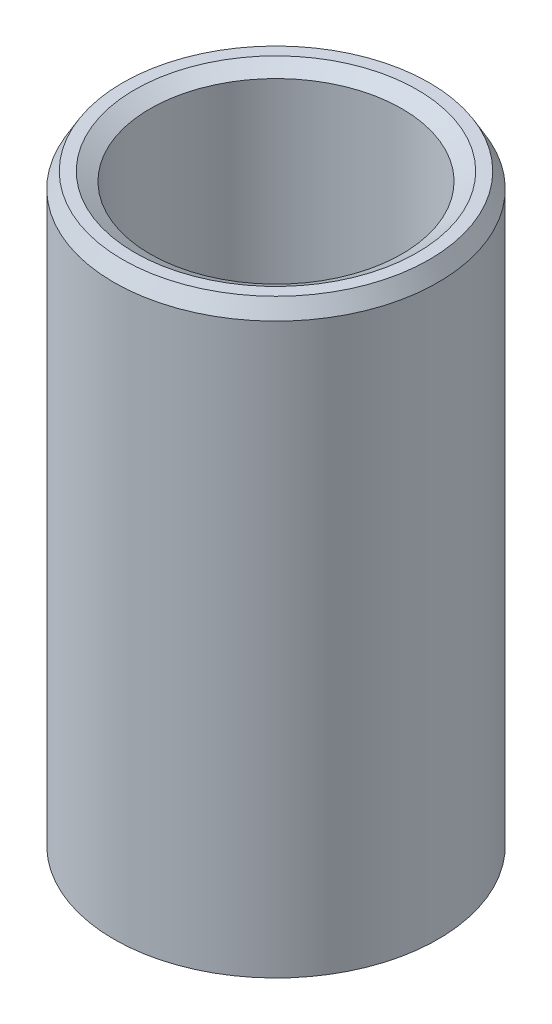
from build123d import *
from OCP.BRepFilletAPI import BRepFilletAPI_MakeChamfer

# Parameters (mm, degrees)
SKETCH1_R           = 15
BOSS_EXTRUDE1_DEPTH = 54.86769485
SKETCH2_R           = 11.651076825
CUT_EXTRUDE1_DEPTH  = 59.82570814
CHAMFER1_SIZE       = 1.415614988
CHAMFER1_SIZE2      = 0.817305694


with BuildPart() as part:
    # Sketch1 → Boss-Extrude1 (new body)
    with BuildSketch(Plane(origin=(0, 0, 0), x_dir=(1, 0, 0), z_dir=(0, 1, 0))):
        Circle(SKETCH1_R)
    extrude(amount=BOSS_EXTRUDE1_DEPTH)

    # Sketch2 → Cut-Extrude1 (cut, through all)
    with BuildSketch(Plane(origin=(0, 0, 0), x_dir=(1, 0, 0), z_dir=(0, 1, 0))):
        Circle(SKETCH2_R)
    extrude(amount=CUT_EXTRUDE1_DEPTH, mode=Mode.SUBTRACT)

    # Chamfer1: one chamfer whose edges measure the first distance from different faces: ONE call of the kernel's chamfer builder (chamfer() names one face for all edges)
    chamfer1_edges_1 = [part.edges().sort_by_distance(p)[0] for p in [
        (-11.651076825, 54.86769485, 0),
    ]]
    chamfer1_side_1 = [part.faces().sort_by_distance(p)[0] for p in [
        (-14.575735931, 54.86769485, 0),
    ]]
    chamfer1_edges_2 = [part.edges().sort_by_distance(p)[0] for p in [
        (-11.651076825, 0, 0),
    ]]
    chamfer1_side_2 = [part.faces().sort_by_distance(p)[0] for p in [
        (-11.651076825, 27.433847425, 0),
    ]]
    chamfer1_edges_3 = [part.edges().sort_by_distance(p)[0] for p in [
        (-15, 0, 0),
    ]]
    chamfer1_side_3 = [part.faces().sort_by_distance(p)[0] for p in [
        (-14.575735931, 0, 0),
    ]]
    chamfer1_edges_4 = [part.edges().sort_by_distance(p)[0] for p in [
        (-15, 54.86769485, 0),
    ]]
    chamfer1_side_4 = [part.faces().sort_by_distance(p)[0] for p in [
        (-15, 27.433847425, 0),
    ]]
    chamfer1 = BRepFilletAPI_MakeChamfer(part.part.solid().wrapped)
    for e in chamfer1_edges_1:
        chamfer1.Add(CHAMFER1_SIZE, CHAMFER1_SIZE2, e.wrapped, chamfer1_side_1[0].wrapped)  # the first distance lies on this face
    for e in chamfer1_edges_2:
        chamfer1.Add(CHAMFER1_SIZE, CHAMFER1_SIZE2, e.wrapped, chamfer1_side_2[0].wrapped)  # the first distance lies on this face
    for e in chamfer1_edges_3:
        chamfer1.Add(CHAMFER1_SIZE, CHAMFER1_SIZE2, e.wrapped, chamfer1_side_3[0].wrapped)  # the first distance lies on this face
    for e in chamfer1_edges_4:
        chamfer1.Add(CHAMFER1_SIZE, CHAMFER1_SIZE2, e.wrapped, chamfer1_side_4[0].wrapped)  # the first distance lies on this face
    add(Compound.cast(chamfer1.Shape()), mode=Mode.REPLACE)


solid = part.part
